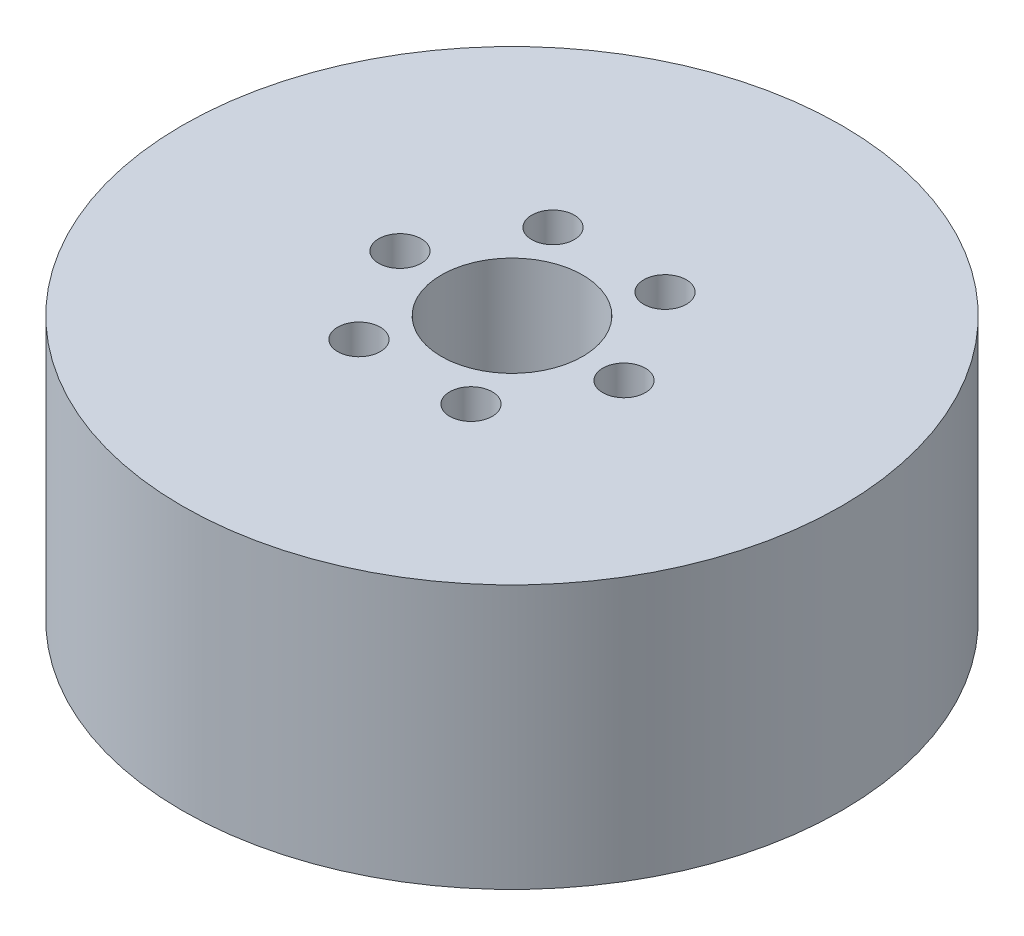
from build123d import *

# Parameters (mm, degrees)
SKETCH1_R           = 35
BOSS_EXTRUDE1_DEPTH = 28
SKETCH2_R           = 7.5
CUT_EXTRUDE1_DEPTH  = 57.868268832
SKETCH3_R           = 2.261160941
CUT_EXTRUDE2_DEPTH  = 26.03903874
CIRPATTERN1_COUNT   = 6


with BuildPart() as part:
    # Sketch1 → Boss-Extrude1 (new body)
    with BuildSketch(Plane(origin=(0, 0, 0), x_dir=(1, 0, 0), z_dir=(0, 1, 0))):
        Circle(SKETCH1_R)
    extrude(amount=BOSS_EXTRUDE1_DEPTH)

    # Sketch2 → Cut-Extrude1 (cut, through all)
    with BuildSketch(Plane(origin=(0, 0, 0), x_dir=(1, 0, 0), z_dir=(0, 1, 0))):
        Circle(SKETCH2_R)
    extrude(amount=CUT_EXTRUDE1_DEPTH, mode=Mode.SUBTRACT)

    # Sketch3 → Cut-Extrude2 (cut)
    with BuildSketch(Plane(origin=(0, 28, 0), x_dir=(1, 0, 0), z_dir=(0, 1, 0))):
        with Locations((-11.892772504, 0)):
            Circle(SKETCH3_R)
    cut_extrude2 = extrude(amount=-CUT_EXTRUDE2_DEPTH, mode=Mode.SUBTRACT)

    # CirPattern1: Cut-Extrude2 ×6 about axis
    cirpattern1_axis = Axis((0, 0, 0), (0, 1, 0))
    for i in range(1, CIRPATTERN1_COUNT):
        add(cut_extrude2.rotate(cirpattern1_axis, i * 360 / CIRPATTERN1_COUNT), mode=Mode.SUBTRACT)


solid = part.part
